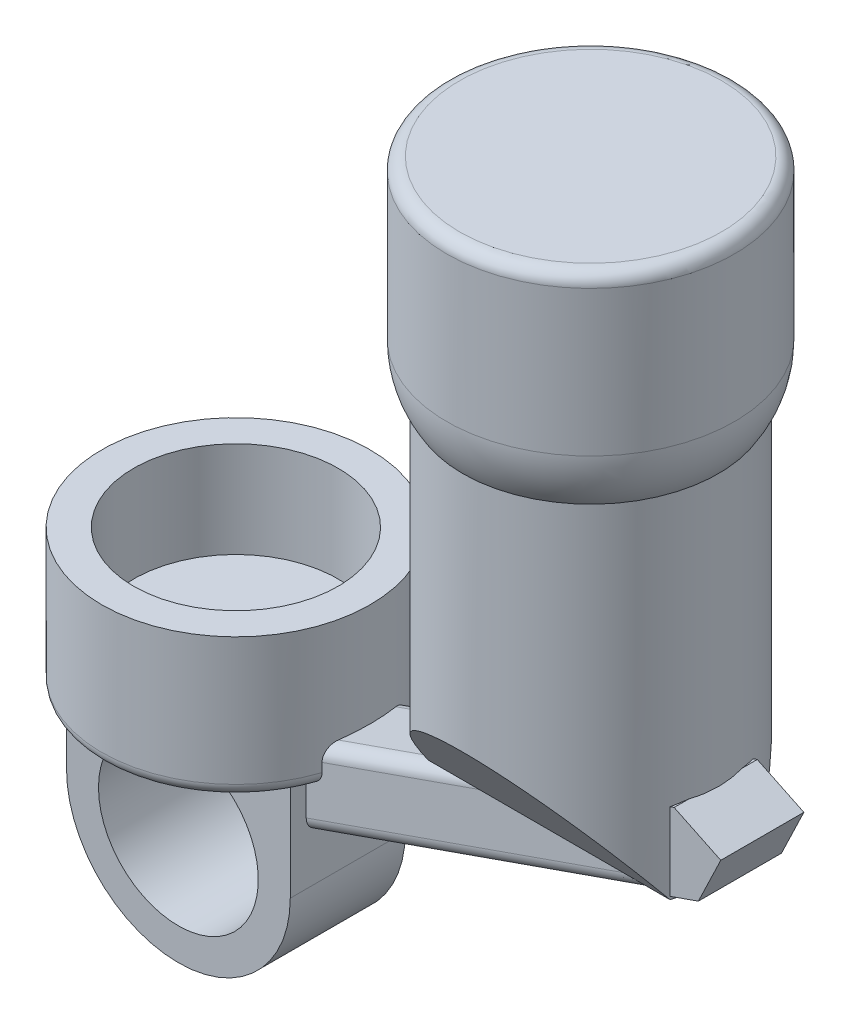
from build123d import *

# Parameters (mm, degrees)
SKETCH1_R           = 21
BOSS_EXTRUDE1_DEPTH = 22
SKETCH3_W           = 35
SKETCH3_H           = 18
BOSS_EXTRUDE2_DEPTH = 15
BOSS_EXTRUDE3_DEPTH = 9
SKETCH6_R           = 12.5
CUT_EXTRUDE1_DEPTH  = 18
BOSS_EXTRUDE5_DEPTH = 6.5
SKETCH9_R           = 20
BOSS_EXTRUDE6_DEPTH = 55
SKETCH10_R          = 22.5
BOSS_EXTRUDE7_DEPTH = 33
FILLET1_R           = 15
CHAMFER2_SIZE       = 10
FILLET3_R           = 2
FILLET4_R           = 2
FILLET5_R           = 2
CUT_EXTRUDE4_DEPTH  = 25
SKETCH13_R          = 16
CUT_EXTRUDE6_DEPTH  = 15


with BuildPart() as part:
    # Sketch1 → Boss-Extrude1 (new body)
    with BuildSketch(Plane(origin=(0, 0, 0), x_dir=(1, 0, 0), z_dir=(0, 1, 0))):
        with Locations(Location((0, 0, 0), (0, 0, 270))):
            Circle(SKETCH1_R)
    extrude(amount=BOSS_EXTRUDE1_DEPTH)

    # Sketch3 → Boss-Extrude2 (add)
    with BuildSketch(Plane.XZ):
        Rectangle(SKETCH3_W, SKETCH3_H)
    extrude(amount=BOSS_EXTRUDE2_DEPTH)

    # Sketch5 → Boss-Extrude3 (add, symmetric)
    with BuildSketch(Plane.XY):
        with BuildLine():
            Line((-17.5, -15), (17.5, -15))
            ThreePointArc((17.5, -15), (0, -32.5), (-17.5, -15))
        make_face()
    extrude(amount=BOSS_EXTRUDE3_DEPTH, both=True)

    # Sketch6 → Cut-Extrude1 (cut)
    with BuildSketch(Plane(origin=(0, 0, -9), x_dir=(-1, 0, 0), z_dir=(0, 0, -1))):
        with Locations((0, -15)):
            Circle(SKETCH6_R)
    extrude(amount=-CUT_EXTRUDE1_DEPTH, mode=Mode.SUBTRACT)

    # Sketch7 → Boss-Extrude5 (add, symmetric)
    with BuildSketch(Plane.XY):
        Polygon((17.5, -7.5), (88.273330058, 17.322081953), (84.484801337, 28.124028145), (17.5, 4.63068359), align=None)
    extrude(amount=BOSS_EXTRUDE5_DEPTH, both=True)

    # Sketch9 → Boss-Extrude6 (add)
    with BuildSketch(Plane(origin=(0, 12, 0), x_dir=(1, 0, 0), z_dir=(0, 1, 0))):
        with Locations(Location((55.484801337, 0, 0), (0, 0, 270))):
            Circle(SKETCH9_R)
    extrude(amount=BOSS_EXTRUDE6_DEPTH)

    # Sketch10 → Boss-Extrude7 (add)
    with BuildSketch(Plane(origin=(0, 67, 0), x_dir=(1, 0, 0), z_dir=(0, 1, 0))):
        with Locations(Location((55.484801337, 0, 0), (0, 0, 270))):
            Circle(SKETCH10_R)
    extrude(amount=BOSS_EXTRUDE7_DEPTH)

    # Fillet1
    # the kernel refuses this fillet: 15 mm, written as the material it takes off along each edge
    with BuildSketch(Plane(origin=(55.484801337, 67, 0), x_dir=(0, 0, 1), z_dir=(-1, 0, 0))) as fillet1_piece_1:
        with BuildLine():
            CenterArc((7.5, 8.291561976), FILLET1_R, 326.442690238, 33.557309762)
            Line((20, 0), (20.25, -0.16583124))
            ThreePointArc((20.25, -0.16583124), (21.25, -0.3), (22.5, -0.3))
            Line((22.5, -0.3), (22.8, 0))
            Line((22.8, 0), (22.8, 8.291561976))
            Line((22.8, 8.291561976), (22.5, 8.291561976))
        make_face()
    revolve(axis=Axis((55.484801337, 67, 0), (0, 1, 0)), mode=Mode.SUBTRACT)

    # Chamfer2
    # the kernel refuses this chamfer: 10 mm, written as the material it takes off along each edge
    with BuildSketch(Plane(origin=(84.484801337, 28.124028145, -32.21682988), x_dir=(-0.9523876901556013, -0.30488963189993584, 0), z_dir=(0, 0, 1))) as chamfer2_piece_1_section:
        Polygon((CHAMFER2_SIZE * 0.999621916911, CHAMFER2_SIZE * 0.0274958766106), (-CHAMFER2_SIZE * 0.0274958766106, CHAMFER2_SIZE * 0.999621916911), (0, 0), align=None)
    chamfer2_piece_1 = extrude(amount=64.433659759, mode=Mode.PRIVATE)
    chamfer2_piece_1 = chamfer2_piece_1 - Plane(origin=(55.484801337, 23.91959175, 0), x_dir=(0, 0, 1), z_dir=(0, -1, 0)) * Cylinder(20, 169, mode=Mode.PRIVATE)
    add(chamfer2_piece_1, mode=Mode.SUBTRACT)
    with BuildSketch(Plane(origin=(88.273330058, 17.322081953, -32.21682988), x_dir=(-0.9341875594200248, -0.3567822919160335, 0), z_dir=(0, 0, 1))) as chamfer2_piece_2:
        Polygon((CHAMFER2_SIZE * 0.999621916911, -CHAMFER2_SIZE * 0.0274958766106), (-CHAMFER2_SIZE * 0.0274958766106, -CHAMFER2_SIZE * 0.999621916911), (0, 0), align=None)
    extrude(amount=64.433659759, mode=Mode.SUBTRACT)

    # Fillet3
    fillet3_edges = [part.edges().sort_by_distance(p)[0] for p in [
        (45.299439603, 2.25, -6.5),
        (29.240150797, 8.748265524, -6.5),
        (29.240150797, 8.748265524, 6.5),
        (45.299439603, 2.25, 6.5),
    ]]
    fillet(fillet3_edges, radius=FILLET3_R)

    # Fillet4
    # the kernel refuses this fillet: 2 mm, written as the material it takes off along each edge
    with BuildSketch(Plane(origin=(0, 0, 0), x_dir=(0.9971250818764672, 0, -0.07577315548958338), z_dir=(0.07577315548958338, 0, 0.9971250818764672))) as fillet4_piece_1_section:
        with BuildLine():
            CenterArc((21 - FILLET4_R, FILLET4_R), FILLET4_R, 270, 90)
            Line((21 - FILLET4_R, 0), (21, 0))
            Line((21, 0), (21, FILLET4_R))
        make_face()
    fillet4_piece_1 = revolve(axis=Axis((0, 0, 0), (0, 1, 0)), revolution_arc=265.654352731, mode=Mode.PRIVATE)
    fillet4_piece_1 = split(fillet4_piece_1, bisect_by=Plane(origin=(19.021746519, 0.448100529, -6.5), z_dir=(0, 0, -1)), keep=Keep.TOP, mode=Mode.PRIVATE)
    fillet4_piece_1 = split(fillet4_piece_1, bisect_by=Plane(origin=(17.5, 0.448100529, -7.756660991), z_dir=(1, 0, 0)), keep=Keep.TOP, mode=Mode.PRIVATE)
    add(fillet4_piece_1, mode=Mode.SUBTRACT)
    with BuildSketch(Plane(origin=(0, 0, 0), x_dir=(0.9971250818764672, 0, -0.07577315548958338), z_dir=(0.07577315548958338, 0, 0.9971250818764672))) as fillet4_piece_2_section:
        with BuildLine():
            CenterArc((21 - FILLET4_R, FILLET4_R), FILLET4_R, 270, 90)
            Line((21 - FILLET4_R, 0), (21, 0))
            Line((21, 0), (21, FILLET4_R))
        make_face()
    fillet4_piece_2 = revolve(axis=Axis((0, 0, 0), (0, 1, 0)), revolution_arc=265.654352731, mode=Mode.PRIVATE)
    fillet4_piece_2 = split(fillet4_piece_2, bisect_by=Plane(origin=(0, 0.562448444, -9), z_dir=(0, 0, -1)), keep=Keep.TOP, mode=Mode.PRIVATE)
    add(fillet4_piece_2, mode=Mode.SUBTRACT)
    with BuildSketch(Plane(origin=(0, 0, 0), x_dir=(0.9971250818764672, 0, -0.07577315548958338), z_dir=(0.07577315548958338, 0, 0.9971250818764672))) as fillet4_piece_3_section:
        with BuildLine():
            CenterArc((21 - FILLET4_R, FILLET4_R), FILLET4_R, 270, 90)
            Line((21 - FILLET4_R, 0), (21, 0))
            Line((21, 0), (21, FILLET4_R))
        make_face()
    fillet4_piece_3 = revolve(axis=Axis((0, 0, 0), (0, 1, 0)), revolution_arc=265.654352731, mode=Mode.PRIVATE)
    fillet4_piece_3 = split(fillet4_piece_3, bisect_by=Plane(origin=(-17.5, 0.448099897, -7.756661101), z_dir=(-1, 0, 0)), keep=Keep.TOP, mode=Mode.PRIVATE)
    add(fillet4_piece_3, mode=Mode.SUBTRACT)
    with BuildSketch(Plane(origin=(0, 0, 0), x_dir=(0.9971250818764672, 0, -0.07577315548958338), z_dir=(0.07577315548958338, 0, 0.9971250818764672))) as fillet4_piece_4_section:
        with BuildLine():
            CenterArc((21 - FILLET4_R, FILLET4_R), FILLET4_R, 270, 90)
            Line((21 - FILLET4_R, 0), (21, 0))
            Line((21, 0), (21, FILLET4_R))
        make_face()
    fillet4_piece_4 = revolve(axis=Axis((0, 0, 0), (0, 1, 0)), revolution_arc=265.654352731, mode=Mode.PRIVATE)
    fillet4_piece_4 = split(fillet4_piece_4, bisect_by=Plane(origin=(-10.643200487, 0.567263166, 9), z_dir=(0, 0, 1)), keep=Keep.TOP, mode=Mode.PRIVATE)
    add(fillet4_piece_4, mode=Mode.SUBTRACT)
    with BuildSketch(Plane(origin=(0, 0, 0), x_dir=(0, 0, 1), z_dir=(-1, 0, 0))) as fillet4_piece_5_section:
        with BuildLine():
            CenterArc((21 - FILLET4_R, FILLET4_R), FILLET4_R, 270, 90)
            Line((21 - FILLET4_R, 0), (21, 0))
            Line((21, 0), (21, FILLET4_R))
        make_face()
    fillet4_piece_5 = revolve(axis=Axis((0, 0, 0), (0, 1, 0)), revolution_arc=85.61482077, mode=Mode.PRIVATE)
    fillet4_piece_5 = split(fillet4_piece_5, bisect_by=Plane(origin=(10.643200508, 0.567263125, 9), z_dir=(0, 0, 1)), keep=Keep.TOP, mode=Mode.PRIVATE)
    add(fillet4_piece_5, mode=Mode.SUBTRACT)
    with BuildSketch(Plane(origin=(0, 0, 0), x_dir=(0, 0, 1), z_dir=(-1, 0, 0))) as fillet4_piece_6_section:
        with BuildLine():
            CenterArc((21 - FILLET4_R, FILLET4_R), FILLET4_R, 270, 90)
            Line((21 - FILLET4_R, 0), (21, 0))
            Line((21, 0), (21, FILLET4_R))
        make_face()
    fillet4_piece_6 = revolve(axis=Axis((0, 0, 0), (0, 1, 0)), revolution_arc=85.61482077, mode=Mode.PRIVATE)
    fillet4_piece_6 = split(fillet4_piece_6, bisect_by=Plane(origin=(19.021746751, 0.448100278, 6.5), z_dir=(0, 0, 1)), keep=Keep.TOP, mode=Mode.PRIVATE)
    fillet4_piece_6 = split(fillet4_piece_6, bisect_by=Plane(origin=(17.5, 0.448100278, 7.756660688), z_dir=(1, 0, 0)), keep=Keep.TOP, mode=Mode.PRIVATE)
    add(fillet4_piece_6, mode=Mode.SUBTRACT)

    # Fillet5
    fillet5_edges = [part.edges().sort_by_distance(p)[0] for p in [
        (55.484801337, 100, -22.5),
    ]]
    fillet(fillet5_edges, radius=FILLET5_R)

    # Sketch12 → Cut-Extrude4 (cut, symmetric)
    with BuildSketch(Plane(origin=(55, 0, 0), x_dir=(0, 0, -1), z_dir=(1, 0, 0))):
        Polygon((6.5, 12), (20, 29.283691076), (20, 12), align=None)
        Polygon((-20, 12), (-6.5, 12), (-20, 29.283691076), align=None)
    extrude(amount=CUT_EXTRUDE4_DEPTH, both=True, mode=Mode.SUBTRACT)

    # Sketch13 → Cut-Extrude6 (cut)
    with BuildSketch(Plane(origin=(0, 22, 0), x_dir=(1, 0, 0), z_dir=(0, 1, 0))):
        with Locations(Location((0, 0, 0), (0, 0, 270))):
            Circle(SKETCH13_R)
    extrude(amount=-CUT_EXTRUDE6_DEPTH, mode=Mode.SUBTRACT)


solid = part.part
